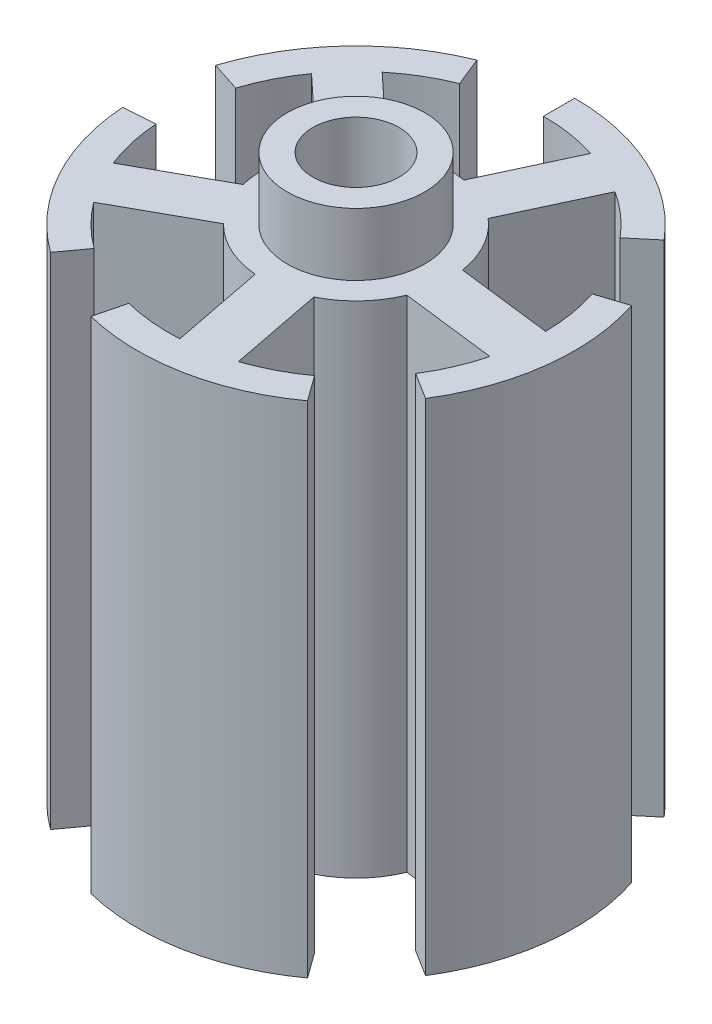
from build123d import *

# Parameters (mm, degrees)
BOSS_EXTRUDE2_DEPTH   = 40
BOSS_EXTRUDE2_2_DEPTH = 40
BOSS_EXTRUDE2_3_DEPTH = 40
BOSS_EXTRUDE2_4_DEPTH = 40
BOSS_EXTRUDE2_5_DEPTH = 40
BOSS_EXTRUDE3_DEPTH   = 40
SKETCH3_R             = 7.5
BOSS_EXTRUDE4_DEPTH   = 40
SKETCH5_R             = 5.5
BOSS_EXTRUDE5_DEPTH   = 5
SKETCH4_R             = 3.45
CUT_EXTRUDE1_DEPTH    = 45


with BuildPart() as part:
    # Sketch1 → Boss-Extrude2 (new body)
    with BuildSketch(Plane(origin=(0, 0, 0), x_dir=(1, 0, 0), z_dir=(0, 1, 0))):
        with BuildLine():
            Line((0, 17.5), (0, 15))
            ThreePointArc((0, 15), (6.339273926, 13.594616806), (11.490666647, 9.641814145))
            Line((11.490666647, 9.641814145), (13.405777755, 11.24878317))
            ThreePointArc((13.405777755, 11.24878317), (7.39581958, 15.860386273), (0, 17.5))
        make_face()
    extrude(amount=BOSS_EXTRUDE2_DEPTH)



with BuildPart() as body_2:
    # Sketch1 → Boss-Extrude2 2 (new body)
    with BuildSketch(Plane(origin=(0, 0, 0), x_dir=(1, 0, 0), z_dir=(0, 1, 0))):
        with BuildLine():
            Line((16.643489035, 5.407797402), (14.265847744, 4.635254916))
            ThreePointArc((14.265847744, 4.635254916), (14.888192275, -1.828040151), (12.720721442, -7.948788963))
            Line((12.720721442, -7.948788963), (14.840841683, -9.273587124))
            ThreePointArc((14.840841683, -9.273587124), (17.369557654, -2.13271351), (16.643489035, 5.407797402))
        make_face()
    extrude(amount=BOSS_EXTRUDE2_2_DEPTH)


with BuildPart() as body_3:
    # Sketch1 → Boss-Extrude2 3 (new body)
    with BuildSketch(Plane(origin=(0, 0, 0), x_dir=(1, 0, 0), z_dir=(0, 1, 0))):
        with BuildLine():
            Line((10.286241915, -14.157797402), (8.816778784, -12.135254916))
            ThreePointArc((8.816778784, -12.135254916), (2.862134931, -14.724407752), (-3.628828434, -14.554435894))
            Line((-3.628828434, -14.554435894), (-4.233633173, -16.98017521))
            ThreePointArc((-4.233633173, -16.98017521), (3.339157419, -17.17847571), (10.286241915, -14.157797402))
        make_face()
    extrude(amount=BOSS_EXTRUDE2_3_DEPTH)


with BuildPart() as body_4:
    # Sketch1 → Boss-Extrude2 4 (new body)
    with BuildSketch(Plane(origin=(0, 0, 0), x_dir=(1, 0, 0), z_dir=(0, 1, 0))):
        with BuildLine():
            Line((-10.286241915, -14.157797402), (-8.816778784, -12.135254916))
            ThreePointArc((-8.816778784, -12.135254916), (-13.119295607, -7.272144304), (-14.963460754, -1.046347106))
            Line((-14.963460754, -1.046347106), (-17.45737088, -1.220738291))
            ThreePointArc((-17.45737088, -1.220738291), (-15.305844875, -8.484168354), (-10.286241915, -14.157797402))
        make_face()
    extrude(amount=BOSS_EXTRUDE2_4_DEPTH)


with BuildPart() as body_5:
    # Sketch1 → Boss-Extrude2 5 (new body)
    with BuildSketch(Plane(origin=(0, 0, 0), x_dir=(1, 0, 0), z_dir=(0, 1, 0))):
        with BuildLine():
            Line((-16.643489035, 5.407797402), (-14.265847744, 4.635254916))
            ThreePointArc((-14.265847744, 4.635254916), (-10.970305524, 10.229975401), (-5.619098901, 13.907757819))
            Line((-5.619098901, 13.907757819), (-6.555615385, 16.225717455))
            ThreePointArc((-6.555615385, 16.225717455), (-12.798689778, 11.934971301), (-16.643489035, 5.407797402))
        make_face()
    extrude(amount=BOSS_EXTRUDE2_5_DEPTH)


with BuildPart() as part_1:
    add(part.part)

    add(body_2.part)  # Boss-Extrude3 merges body 2

    add(body_3.part)  # Boss-Extrude3 merges body 3

    add(body_4.part)  # Boss-Extrude3 merges body 4

    add(body_5.part)  # Boss-Extrude3 merges body 5
    # Sketch2 → Boss-Extrude3 (add)
    with BuildSketch(Plane(origin=(0, 0, 0), x_dir=(1, 0, 0), z_dir=(0, 1, 0))):
        Polygon((2.975983844, 1.649614781), (8.1518895, 12.749380282), (4.526658352, 14.439853329), (-0.649247305, 3.340087828), (-9.606308804, 11.692682804), (-12.334302244, 8.767267998), (-3.377240745, 0.414673022), (-14.088914848, -5.522904889), (-12.149676367, -9.021383718), (-1.438002264, -3.083805807), (0.898880564, -15.106025742), (4.825389298, -14.342789761), (2.48850647, -2.320569825), (14.644453588, -3.813132454), (15.131930961, 0.157052152), align=None)
        Polygon((-0.334260109, 0.311702594), (0.152686649, 0.084635592), (0.087207921, -0.448645859), align=None, mode=Mode.SUBTRACT)
    extrude(amount=BOSS_EXTRUDE3_DEPTH)

    # Sketch3 → Boss-Extrude4 (add)
    with BuildSketch(Plane(origin=(0, 0, 0), x_dir=(1, 0, 0), z_dir=(0, 1, 0))):
        Circle(SKETCH3_R)
    extrude(amount=BOSS_EXTRUDE4_DEPTH)

    # Sketch5 → Boss-Extrude5 (add)
    with BuildSketch(Plane(origin=(0, 40, 0), x_dir=(1, 0, 0), z_dir=(0, 1, 0))):
        Circle(SKETCH5_R)
    extrude(amount=BOSS_EXTRUDE5_DEPTH)

    # Sketch4 → Cut-Extrude1 (cut)
    with BuildSketch(Plane(origin=(0, 0, 0), x_dir=(1, 0, 0), z_dir=(0, 1, 0))):
        Circle(SKETCH4_R)
    extrude(amount=CUT_EXTRUDE1_DEPTH, mode=Mode.SUBTRACT)


solid = part_1.part
